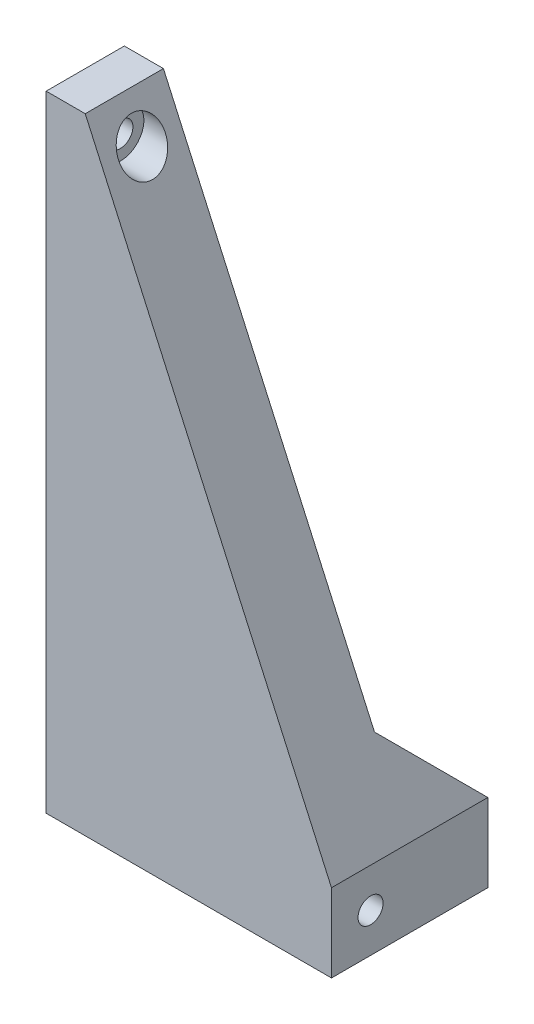
from build123d import *

# Parameters (mm, degrees)
EXTRUDE_1_DEPTH     = 10
SKETCH_2_W          = 36.5
SKETCH_2_H          = 10
EXTRUDE_2_DEPTH     = 10
CHAMFER_1_SIZE      = 10
SKETCH_3_R          = 1.6
CUT_EXTRUDE_1_DEPTH = 89.5
SKETCH_4_R          = 1.6
CUT_EXTRUDE_2_DEPTH = 89.5
SKETCH_5_R          = 3
CUT_EXTRUDE_3_DEPTH = 32
SKETCH_6_R          = 3
CUT_EXTRUDE_4_DEPTH = 67


with BuildPart() as part:
    # ｽｹｯﾁ1 → ﾎﾞｽ - 押し出し1 (new body)
    with BuildSketch(Plane.XY):
        Polygon((0, 0), (0, 80), (5, 80), (36.5, 10), (36.5, 0), align=None)
    extrude(amount=EXTRUDE_1_DEPTH)

    # ｽｹｯﾁ2 → ﾎﾞｽ - 押し出し2 (add)
    with BuildSketch(Plane(origin=(0, 0, 0), x_dir=(-1, 0, 0), z_dir=(0, 0, -1))):
        with Locations((-18.25, 5)):
            Rectangle(SKETCH_2_W, SKETCH_2_H)
    extrude(amount=EXTRUDE_2_DEPTH)

    # 面取り1
    chamfer_1_edges = [part.edges().sort_by_distance(p)[0] for p in [
        (18.25, 10, 0),
    ]]
    chamfer(chamfer_1_edges, length=CHAMFER_1_SIZE - 0.0001)  # a hair under: the kernel refuses the full size

    # ｽｹｯﾁ3 → ｶｯﾄ - 押し出し1 (cut, through all)
    with BuildSketch(Plane(origin=(36.5, 0, 0), x_dir=(0, 0, -1), z_dir=(1, 0, 0))):
        with Locations((-5, 5)):
            Circle(SKETCH_3_R)
        with Locations((-5, 75)):
            Circle(SKETCH_3_R)
    extrude(amount=-CUT_EXTRUDE_1_DEPTH, mode=Mode.SUBTRACT)

    # ｽｹｯﾁ4 → ｶｯﾄ - 押し出し2 (cut, through all)
    with BuildSketch(Plane(origin=(0, 0, 0), x_dir=(-1, 0, 0), z_dir=(0, -1, 0))):
        with Locations(Location((-28.9, 5, 0), (0, 0, 180))):
            Circle(SKETCH_4_R)
    extrude(amount=-CUT_EXTRUDE_2_DEPTH, mode=Mode.SUBTRACT)

    # ｽｹｯﾁ5 → ｶｯﾄ - 押し出し3 (cut)
    with BuildSketch(Plane(origin=(36.5, 0, 0), x_dir=(0, 0, -1), z_dir=(1, 0, 0))):
        with Locations((-5, 75)):
            Circle(SKETCH_5_R)
    extrude(amount=-CUT_EXTRUDE_3_DEPTH, mode=Mode.SUBTRACT)

    # ｽｹｯﾁ6 → ｶｯﾄ - 押し出し4 (cut)
    with BuildSketch(Plane(origin=(0, 80, 0), x_dir=(1, 0, 0), z_dir=(0, 1, 0))):
        with Locations((28.9, 5)):
            Circle(SKETCH_6_R)
    extrude(amount=-CUT_EXTRUDE_4_DEPTH, mode=Mode.SUBTRACT)


solid = part.part
